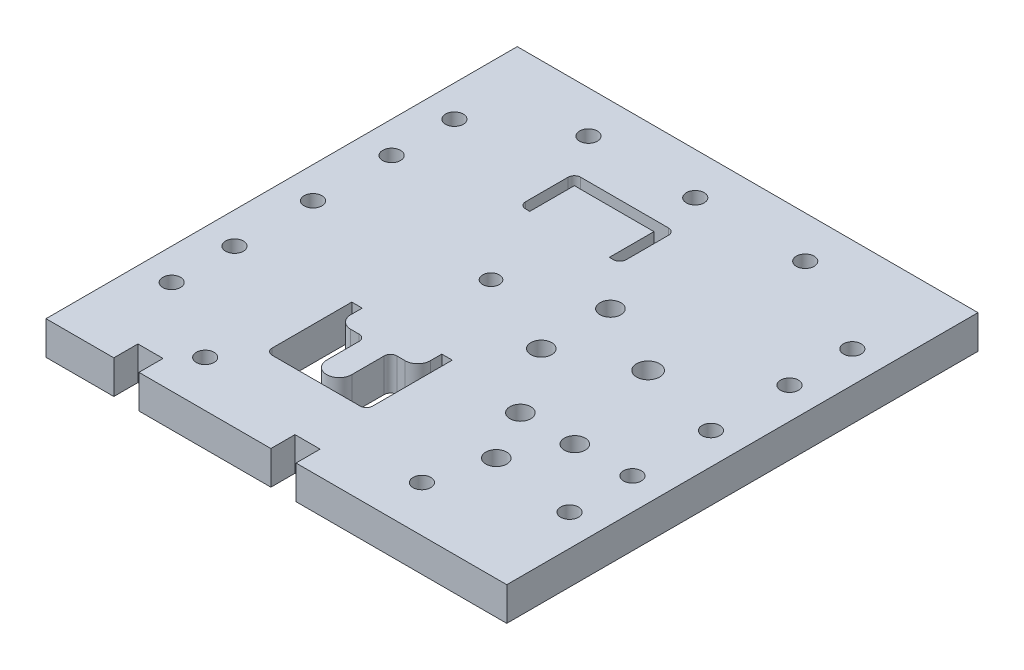
from build123d import *

# Parameters (mm, degrees)
SKETCH1_W              = 220
SKETCH1_H              = 225
BOSS_EXTRUDE1_DEPTH    = 16
CUT_EXTRUDE1_REACH     = 160.153
SKETCH2_R              = 4
CUT_EXTRUDE2_REACH     = 160.153
SKETCH3_W              = 12
SKETCH3_H              = 11.5
LPATTERN1_COUNT        = 2
LPATTERN1_PITCH        = 75
SKETCH4_R              = 8.5
CUT_EXTRUDE3_DEPTH     = 5
M10_TAPPED_HOLE2_D     = 8.5
M10_TAPPED_HOLE3_D     = 8.5
M10_TAPPED_HOLE4_D     = 8.5
CUT_EXTRUDE4_REACH     = 160.153
CUT_EXTRUDE6_REACH     = 160.153
F_10_0MM_DOWEL_HOLE1_D = 10
CUT_EXTRUDE7_REACH     = 160.153
SKETCH34_R             = 5


with BuildPart() as part:
    # Sketch1 → Boss-Extrude1 (new body)
    with BuildSketch(Plane(origin=(0, 0, 0), x_dir=(1, 0, 0), z_dir=(0, 1, 0))):
        Rectangle(SKETCH1_W, SKETCH1_H)
    extrude(amount=-BOSS_EXTRUDE1_DEPTH)

    # Sketch2 → Cut-Extrude1 (cut, up to next)
    with BuildSketch(Plane(origin=(0, 0, 0), x_dir=(1, 0, 0), z_dir=(0, 1, 0)), mode=Mode.PRIVATE) as cut_extrude1_sk1:
        with Locations((-19.87, 9.86)):
            Circle(SKETCH2_R)
    cut_extrude1_tool1 = extrude(cut_extrude1_sk1.sketch, amount=-CUT_EXTRUDE1_REACH, mode=Mode.PRIVATE) & part.part
    add(cut_extrude1_tool1.solids().sort_by_distance((-19.87, 0, -9.86))[0], mode=Mode.SUBTRACT)

    # Sketch3 → Cut-Extrude2 (cut, up to next)
    with BuildSketch(Plane.XZ.offset(16), mode=Mode.PRIVATE) as cut_extrude2_sk1:
        with Locations((3.38, 106.75)):
            Rectangle(SKETCH3_W, SKETCH3_H)
    cut_extrude2_tool1 = extrude(cut_extrude2_sk1.sketch, amount=-CUT_EXTRUDE2_REACH, mode=Mode.PRIVATE) & part.part
    cut_extrude2 = cut_extrude2_tool1.solids().sort_by_distance((3.38, -16, 106.75))[0]
    add(cut_extrude2, mode=Mode.SUBTRACT)

    # LPattern1: Cut-Extrude2 ×2
    with Locations(*[(-i * LPATTERN1_PITCH, 0, 0) for i in range(1, LPATTERN1_COUNT)]):
        add(cut_extrude2, mode=Mode.SUBTRACT)

    # Sketch4 → Cut-Extrude3 (cut)
    with BuildSketch(Plane.XZ.offset(16)):
        with Locations((-19.87, 100)):
            Circle(SKETCH4_R)
        with Locations((25, 100)):
            Circle(SKETCH4_R)
        with Locations((70, 100)):
            Circle(SKETCH4_R)
        with Locations((-19.87, -100)):
            Circle(SKETCH4_R)
        with Locations((25, -100)):
            Circle(SKETCH4_R)
        with Locations((70, -100)):
            Circle(SKETCH4_R)
        with Locations((-94.87, 100)):
            Circle(SKETCH4_R)
        with Locations((-94.87, -100)):
            Circle(SKETCH4_R)
    extrude(amount=-CUT_EXTRUDE3_DEPTH, mode=Mode.SUBTRACT)

    # M10 Tapped Hole2 (through all)
    with Locations(Plane(origin=(0, 0, 0), x_dir=(1, 0, 0), z_dir=(0, 1, 0))):
        with Locations((-95, -67.5), (-95, -37.5), (-95, 0), (-95, 37.5), (-95, 67.5), (95, 67.5), (95, 37.5), (95, 0), (95, -37.5), (95, -67.5)):
            Hole(M10_TAPPED_HOLE2_D / 2)

    # M10 Tapped Hole3 (through all)
    with Locations(Plane(origin=(0, 0, 0), x_dir=(1, 0, 0), z_dir=(0, 1, 0))):
        with Locations((-56, 92.5), (-5, 92.5), (47.5, 92.5)):
            Hole(M10_TAPPED_HOLE3_D / 2)

    # M10 Tapped Hole4 (through all)
    with Locations(Plane(origin=(0, 0, 0), x_dir=(1, 0, 0), z_dir=(0, 1, 0))):
        with Locations((47.5, -90.5), (-56, -90.5)):
            Hole(M10_TAPPED_HOLE4_D / 2)

    # Sketch24 → Cut-Extrude4 (cut, up to next)
    with BuildSketch(Plane(origin=(0, 0, 0), x_dir=(1, 0, 0), z_dir=(0, 1, 0)), mode=Mode.PRIVATE) as cut_extrude4_sk1:
        with BuildLine():
            Line((4.13, -32.64), (-0.87, -32.64))
            Line((-0.87, -32.64), (-0.87, -38.14))
            ThreePointArc((-0.87, -38.14), (-2.627359313, -42.382640687), (-6.87, -44.14))
            Line((-6.87, -44.14), (-10.87, -44.14))
            ThreePointArc((-10.87, -44.14), (-12.991320344, -45.018679656), (-13.87, -47.14))
            Line((-13.87, -47.14), (-13.87, -62.64))
            ThreePointArc((-13.87, -62.64), (-19.87, -68.64), (-25.87, -62.64))
            Line((-25.87, -62.64), (-25.87, -47.14))
            ThreePointArc((-25.87, -47.14), (-26.748679656, -45.018679656), (-28.87, -44.14))
            Line((-28.87, -44.14), (-32.87, -44.14))
            ThreePointArc((-32.87, -44.14), (-37.112640687, -42.382640687), (-38.87, -38.14))
            Line((-38.87, -38.14), (-38.87, -32.64))
            Line((-38.87, -32.64), (-43.87, -32.64))
            Line((-43.87, -32.64), (-43.87, -70.64))
            ThreePointArc((-43.87, -70.64), (-42.991320344, -72.761320344), (-40.87, -73.64))
            Line((-40.87, -73.64), (1.13, -73.64))
            ThreePointArc((1.13, -73.64), (3.251320344, -72.761320344), (4.13, -70.64))
            Line((4.13, -70.64), (4.13, -32.64))
        make_face()
    cut_extrude4_tool1 = extrude(cut_extrude4_sk1.sketch, amount=-CUT_EXTRUDE4_REACH, mode=Mode.PRIVATE) & part.part
    add(cut_extrude4_tool1.solids().sort_by_distance((3.498731, 0, 51.64))[0], mode=Mode.SUBTRACT)

    # Sketch29 → Cut-Extrude6 (cut, up to next)
    with BuildSketch(Plane.XZ.offset(16), mode=Mode.PRIVATE) as cut_extrude6_sk1:
        with BuildLine():
            Line((-0.87, -47.36), (1.13, -47.36))
            ThreePointArc((1.13, -47.36), (3.251320344, -48.238679656), (4.13, -50.36))
            Line((4.13, -50.36), (4.13, -70.64))
            ThreePointArc((4.13, -70.64), (3.251320344, -72.761320344), (1.13, -73.64))
            Line((1.13, -73.64), (-40.87, -73.64))
            ThreePointArc((-40.87, -73.64), (-42.991320344, -72.761320344), (-43.87, -70.64))
            Line((-43.87, -70.64), (-43.87, -50.36))
            ThreePointArc((-43.87, -50.36), (-42.991320344, -48.238679656), (-40.87, -47.36))
            Line((-40.87, -47.36), (-38.87, -47.36))
            Line((-38.87, -47.36), (-38.87, -68.64))
            Line((-38.87, -68.64), (-0.87, -68.64))
            Line((-0.87, -68.64), (-0.87, -47.36))
        make_face()
    cut_extrude6_tool1 = extrude(cut_extrude6_sk1.sketch, amount=-CUT_EXTRUDE6_REACH, mode=Mode.PRIVATE) & part.part
    add(cut_extrude6_tool1.solids().sort_by_distance((0.13, -16, -47.907233))[0], mode=Mode.SUBTRACT)

    # Ø10.0mm Dowel Hole1 (through all)
    with Locations(Plane(origin=(0, 0, 0), x_dir=(1, 0, 0), z_dir=(0, 1, 0))):
        with Locations((55.13, -62.64), (68.13, -38.14), (42.13, -38.14), (20.63, 26.36), (20.63, -6.64)):
            Hole(F_10_0MM_DOWEL_HOLE1_D / 2)

    # Sketch34 → Cut-Extrude7 (cut, up to next)
    with BuildSketch(Plane(origin=(0, 0, 0), x_dir=(1, 0, 0), z_dir=(0, 1, 0)), mode=Mode.PRIVATE) as cut_extrude7_sk1:
        with Locations((55.13, 9.86)):
            Circle(SKETCH34_R)
    cut_extrude7_tool1 = extrude(cut_extrude7_sk1.sketch, amount=-CUT_EXTRUDE7_REACH, mode=Mode.PRIVATE) & part.part
    add(cut_extrude7_tool1.solids().sort_by_distance((55.13, 0, -9.86))[0], mode=Mode.SUBTRACT)

    # Cut-Sweep1: sweep along a curve in space
    with BuildLine() as cut_sweep1_path:
        ThreePointArc((55.13, 0, -4.86), (58.665533906, 0, -6.324466094), (60.13, 0, -9.86))
        ThreePointArc((60.13, 0, -9.86), (58.665533906, 0, -13.395533906), (55.13, 0, -14.86))
        ThreePointArc((55.13, 0, -14.86), (51.594466094, 0, -13.395533906), (50.13, 0, -9.86))
        ThreePointArc((50.13, 0, -9.86), (51.594466094, 0, -6.324466094), (55.13, 0, -4.86))
    # Sketch35 → Cut-Sweep1 (sweep, cut)
    with BuildSketch(Plane.XY.offset(-9.86)):
        Polygon((60.13, -10), (60.654077793, 0), (60.13, 0), align=None)
    sweep(path=cut_sweep1_path.line, mode=Mode.SUBTRACT)


solid = part.part
